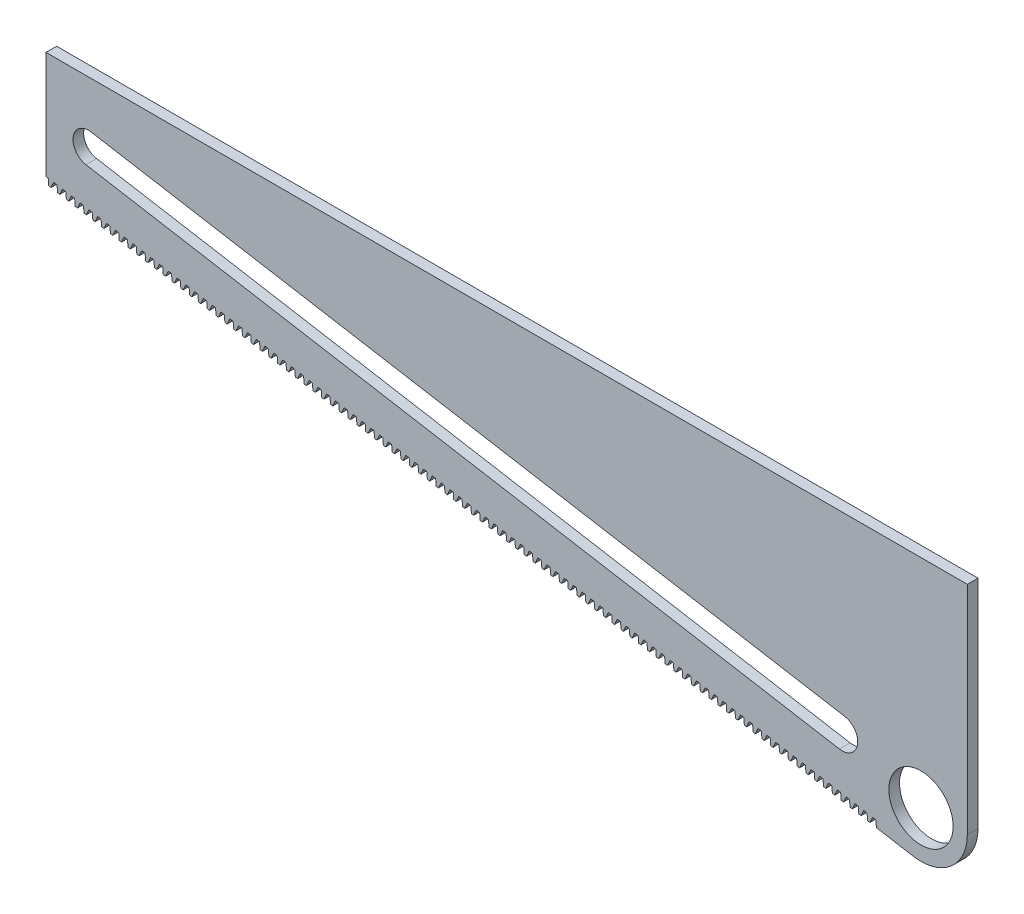
from build123d import *

# Parameters (mm, degrees)
SKETCH1_R           = 14.351
BOSS_EXTRUDE1_DEPTH = 4.7625
CUT_EXTRUDE2_DEPTH  = 246.114977248
LPATTERN2_COUNT     = 95
LPATTERN2_PITCH     = 3.99034


with BuildPart() as part:
    # Sketch1 → Boss-Extrude1 (new body)
    with BuildSketch(Plane.XY):
        with BuildLine():
            Line((165.488658827, -13.163856035), (-221.861341173, 53.297146733))
            Line((-221.861341173, 53.297146733), (-221.861341173, 104.097146733))
            Line((-221.861341173, 104.097146733), (189.69035399, 104.097146733))
            Line((189.69035399, 104.097146733), (189.69035399, 7.239))
            ThreePointArc((189.69035399, 7.239), (182.332208078, -8.588180601), (165.488658827, -13.163856035))
        make_face()
        with Locations((168.98935399, 7.239)):
            Circle(SKETCH1_R, mode=Mode.SUBTRACT)
        with BuildLine():
            Line((132.554906055, 11.815248761), (-203.995093945, 69.560054445))
            ThreePointArc((-203.995093945, 69.560054445), (-209.710524412, 77.642990457), (-201.6275884, 83.358420924))
            Line((-201.6275884, 83.358420924), (134.9224116, 25.61361524))
            ThreePointArc((134.9224116, 25.61361524), (140.637842067, 17.530679228), (132.554906055, 11.815248761))
        make_face(mode=Mode.SUBTRACT)
    extrude(amount=BOSS_EXTRUDE1_DEPTH)

    # Sketch2 → Cut-Extrude2 (cut, through all)
    with BuildSketch(Plane.XY.offset(4.7625)):
        with BuildLine():
            Line((-220.622365573, 53.148973261), (-220.839182438, 55.750542585))
            ThreePointArc((-220.839182438, 55.750542585), (-220.918257826, 55.93120313), (-221.091385419, 56.025638221))
            Line((-221.091385419, 56.025638221), (-222.115857148, 56.20141573))
            ThreePointArc((-222.115857148, 56.20141573), (-222.310562125, 56.170092868), (-222.445336922, 56.026124455))
            Line((-222.445336922, 56.026124455), (-223.516970456, 53.645625754))
            ThreePointArc((-223.516970456, 53.645625754), (-223.539432922, 53.621631019), (-223.571883751, 53.616410542))
            Line((-223.571883751, 53.616410542), (-224.042542467, 53.697165544))
            Line((-224.042542467, 53.697165544), (-224.046837798, 53.672131365))
            Line((-224.046837798, 53.672131365), (-223.576179083, 53.591376363))
            Line((-223.576179083, 53.591376363), (-220.584627075, 53.07808981))
            Line((-220.584627075, 53.07808981), (-220.113968359, 52.997334807))
            Line((-220.113968359, 52.997334807), (-220.109673027, 53.022368986))
            Line((-220.109673027, 53.022368986), (-220.580331743, 53.103123989))
            ThreePointArc((-220.580331743, 53.103123989), (-220.609186342, 53.118863171), (-220.622365573, 53.148973261))
        make_face()
    cut_extrude2 = extrude(amount=-CUT_EXTRUDE2_DEPTH, mode=Mode.SUBTRACT)

    # LPattern2: Cut-Extrude2 ×95
    with Locations(*[Vector(0.9855976056602136, -0.16910753891194252, 0) * (i * LPATTERN2_PITCH) for i in range(1, LPATTERN2_COUNT)]):
        add(cut_extrude2, mode=Mode.SUBTRACT)


solid = part.part
